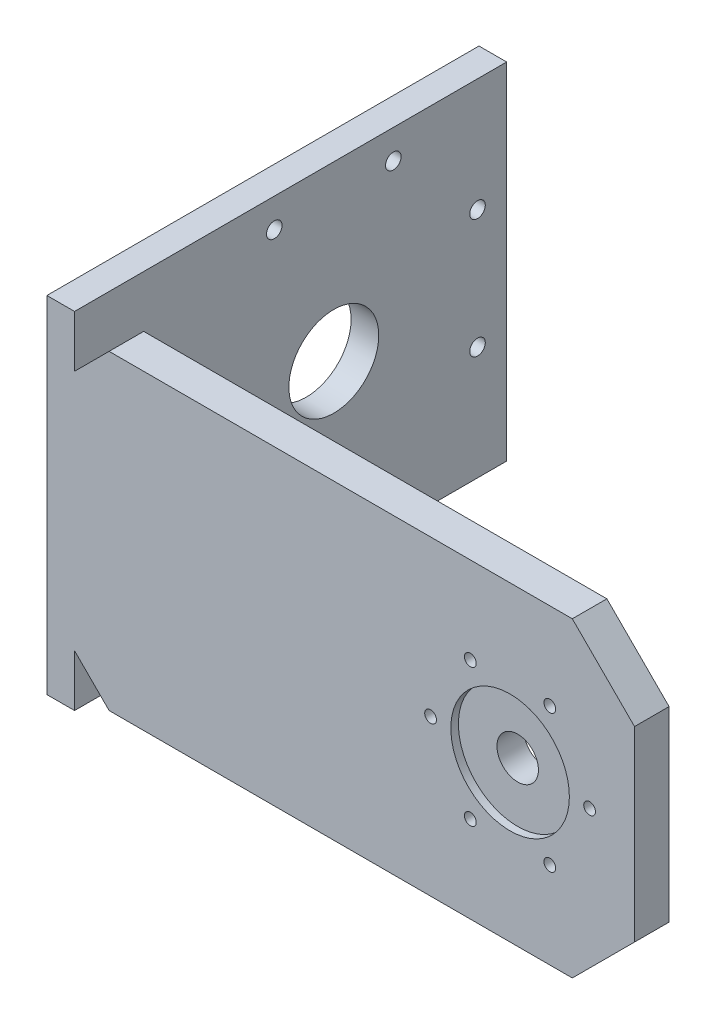
from build123d import *

# Parameters (mm, degrees)
SK_TOP_PLATE_R         = 1.7
SK_TOP_PLATE_R_2       = 6
TOP_PLATE_DEPTH        = 10
SK_YAW_PILOT_RECESS_R  = 17.15
YAW_PILOT_RECESS_DEPTH = 2.2
SK_BACK_PLATE_W        = 125
SK_BACK_PLATE_H        = 100
SK_BACK_PLATE_R        = 2.25
SK_BACK_PLATE_R_2      = 13
BACK_PLATE_DEPTH       = 8
RIB_DEPTH              = 8


with BuildPart() as part:
    # SK_Top_Plate → Top_Plate (new body)
    with BuildSketch(Plane.XY.offset(65)):
        Polygon((-116, -45), (18, -45), (36, -27), (36, 27), (18, 45), (-116, 45), (-134, 27), (-134, -27), align=None)
        with Locations((23, 0)):
            Circle(SK_TOP_PLATE_R, mode=Mode.SUBTRACT)
        with Locations((11.5, 19.918584287)):
            Circle(SK_TOP_PLATE_R, mode=Mode.SUBTRACT)
        with Locations((-11.5, 19.918584287)):
            Circle(SK_TOP_PLATE_R, mode=Mode.SUBTRACT)
        with Locations((-23, 0)):
            Circle(SK_TOP_PLATE_R, mode=Mode.SUBTRACT)
        with Locations((-11.5, -19.918584287)):
            Circle(SK_TOP_PLATE_R, mode=Mode.SUBTRACT)
        with Locations((11.5, -19.918584287)):
            Circle(SK_TOP_PLATE_R, mode=Mode.SUBTRACT)
        Circle(SK_TOP_PLATE_R_2, mode=Mode.SUBTRACT)
    extrude(amount=TOP_PLATE_DEPTH)

    # SK_Yaw_Pilot_Recess → Yaw_Pilot_Recess (cut)
    with BuildSketch(Plane.XY.offset(75)):
        Circle(SK_YAW_PILOT_RECESS_R)
    extrude(amount=-YAW_PILOT_RECESS_DEPTH, mode=Mode.SUBTRACT)

    # SK_Back_Plate → Back_Plate (add)
    with BuildSketch(Plane(origin=(-134, 0, 0), x_dir=(0, 0, -1), z_dir=(1, 0, 0))):
        with Locations((-12.5, 0)):
            Rectangle(SK_BACK_PLATE_W, SK_BACK_PLATE_H)
        with Locations((41.574578963, 17.220754456)):
            Circle(SK_BACK_PLATE_R, mode=Mode.SUBTRACT)
        with Locations((17.220754456, 41.574578963)):
            Circle(SK_BACK_PLATE_R, mode=Mode.SUBTRACT)
        with Locations((-17.220754456, 41.574578963)):
            Circle(SK_BACK_PLATE_R, mode=Mode.SUBTRACT)
        with Locations((-41.574578963, 17.220754456)):
            Circle(SK_BACK_PLATE_R, mode=Mode.SUBTRACT)
        with Locations((-41.574578963, -17.220754456)):
            Circle(SK_BACK_PLATE_R, mode=Mode.SUBTRACT)
        with Locations((-17.220754456, -41.574578963)):
            Circle(SK_BACK_PLATE_R, mode=Mode.SUBTRACT)
        with Locations((17.220754456, -41.574578963)):
            Circle(SK_BACK_PLATE_R, mode=Mode.SUBTRACT)
        with Locations((41.574578963, -17.220754456)):
            Circle(SK_BACK_PLATE_R, mode=Mode.SUBTRACT)
        Circle(SK_BACK_PLATE_R_2, mode=Mode.SUBTRACT)
    extrude(amount=BACK_PLATE_DEPTH)

    # SK_Rib → Rib (add)
    with BuildSketch(Plane(origin=(0, -4, 0), x_dir=(1, 0, 0), z_dir=(0, 1, 0))):
        Polygon((-134, -52), (-30, -65), (-134, -65), align=None)
    extrude(amount=RIB_DEPTH)


solid = part.part
